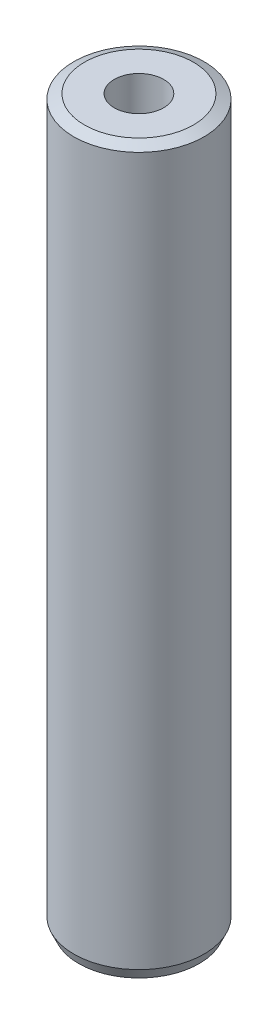
from build123d import *
from OCP.BRepFilletAPI import BRepFilletAPI_MakeChamfer

# Parameters (mm, degrees)
SKETCH1_R           = 37.5
BOSS_EXTRUDE1_DEPTH = 416.345028661
SKETCH2_R           = 14.199533645
CUT_EXTRUDE1_DEPTH  = 420.709045519
CHAMFER1_SIZE       = 2.793352026
CHAMFER1_SIZE2      = 6.152304238


with BuildPart() as part:
    # Sketch1 → Boss-Extrude1 (new body)
    with BuildSketch(Plane(origin=(0, 0, 0), x_dir=(1, 0, 0), z_dir=(0, 1, 0))):
        Circle(SKETCH1_R)
    extrude(amount=BOSS_EXTRUDE1_DEPTH)

    # Sketch2 → Cut-Extrude1 (cut, through all)
    with BuildSketch(Plane(origin=(0, 0, 0), x_dir=(1, 0, 0), z_dir=(0, 1, 0))):
        Circle(SKETCH2_R)
    extrude(amount=CUT_EXTRUDE1_DEPTH, mode=Mode.SUBTRACT)

    # Chamfer1: one chamfer whose edges measure the first distance from different faces: ONE call of the kernel's chamfer builder (chamfer() names one face for all edges)
    chamfer1_edges_1 = [part.edges().sort_by_distance(p)[0] for p in [
        (-37.5, 416.345028661, 0),
    ]]
    chamfer1_side_1 = [part.faces().sort_by_distance(p)[0] for p in [
        (-37.5, 208.17251433, 0),
    ]]
    chamfer1_edges_2 = [part.edges().sort_by_distance(p)[0] for p in [
        (-37.5, 0, 0),
    ]]
    chamfer1_side_2 = [part.faces().sort_by_distance(p)[0] for p in [
        (-36.439339828, 0, 0),
    ]]
    chamfer1 = BRepFilletAPI_MakeChamfer(part.part.solid().wrapped)
    for e in chamfer1_edges_1:
        chamfer1.Add(CHAMFER1_SIZE, CHAMFER1_SIZE2, e.wrapped, chamfer1_side_1[0].wrapped)  # the first distance lies on this face
    for e in chamfer1_edges_2:
        chamfer1.Add(CHAMFER1_SIZE, CHAMFER1_SIZE2, e.wrapped, chamfer1_side_2[0].wrapped)  # the first distance lies on this face
    add(Compound.cast(chamfer1.Shape()), mode=Mode.REPLACE)


solid = part.part
